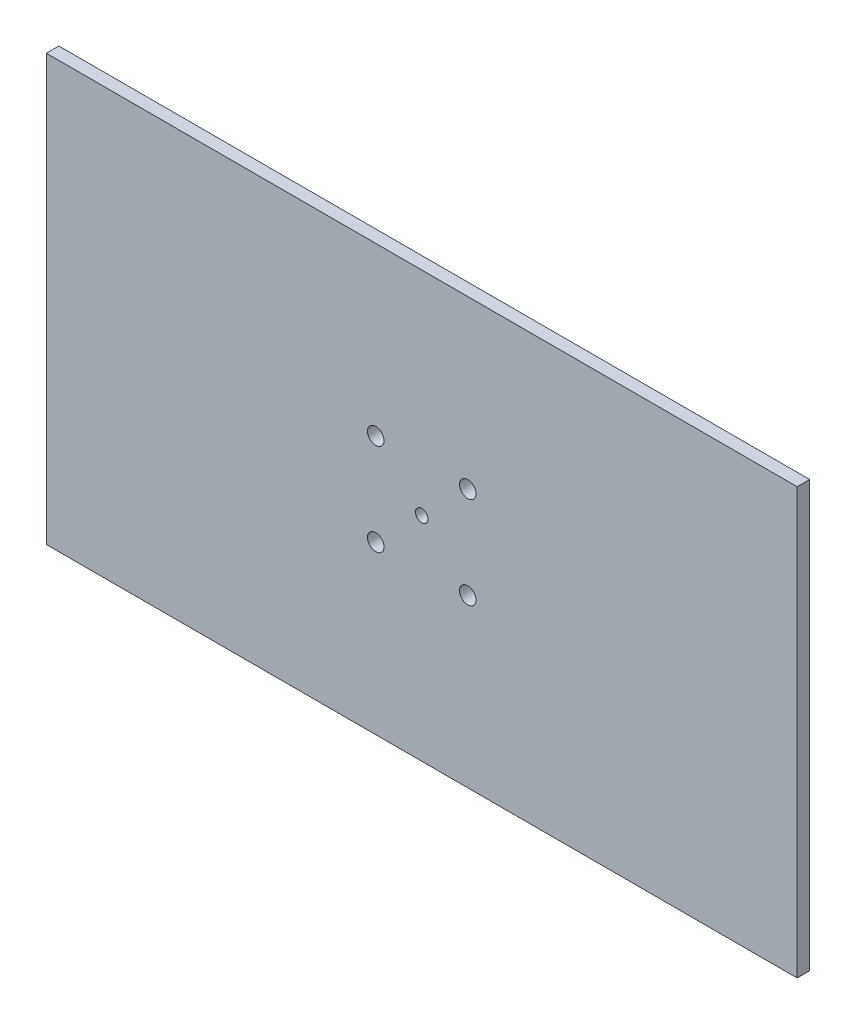
from build123d import *

# Parameters (mm, degrees)
SKETCH_1_W          = 300
SKETCH_1_H          = 250
SKETCH_1_R          = 3.3
SKETCH_1_R_2        = 2.5
EXTRUDE_1_DEPTH     = 5
SKETCH_2_W          = 300
SKETCH_2_H          = 40
CUT_EXTRUDE_1_DEPTH = 196.320249846


with BuildPart() as part:
    # 草图1 → 凸台-拉伸1 (new body)
    with BuildSketch(Plane.XY):
        Rectangle(SKETCH_1_W, SKETCH_1_H)
        with Locations((-18.384776311, 18.384776311)):
            Circle(SKETCH_1_R, mode=Mode.SUBTRACT)
        with Locations((18.384776311, 18.384776311)):
            Circle(SKETCH_1_R, mode=Mode.SUBTRACT)
        with Locations((18.384776311, -18.384776311)):
            Circle(SKETCH_1_R, mode=Mode.SUBTRACT)
        with Locations((-18.384776311, -18.384776311)):
            Circle(SKETCH_1_R, mode=Mode.SUBTRACT)
        Circle(SKETCH_1_R_2, mode=Mode.SUBTRACT)
    extrude(amount=EXTRUDE_1_DEPTH)

    # 草图2 → 切除-拉伸1 (cut, through all)
    with BuildSketch(Plane.XY.offset(5)):
        with Locations((0, 105)):
            Rectangle(SKETCH_2_W, SKETCH_2_H)
        with Locations((0, -105)):
            Rectangle(SKETCH_2_W, SKETCH_2_H)
    extrude(amount=-CUT_EXTRUDE_1_DEPTH, mode=Mode.SUBTRACT)


solid = part.part
